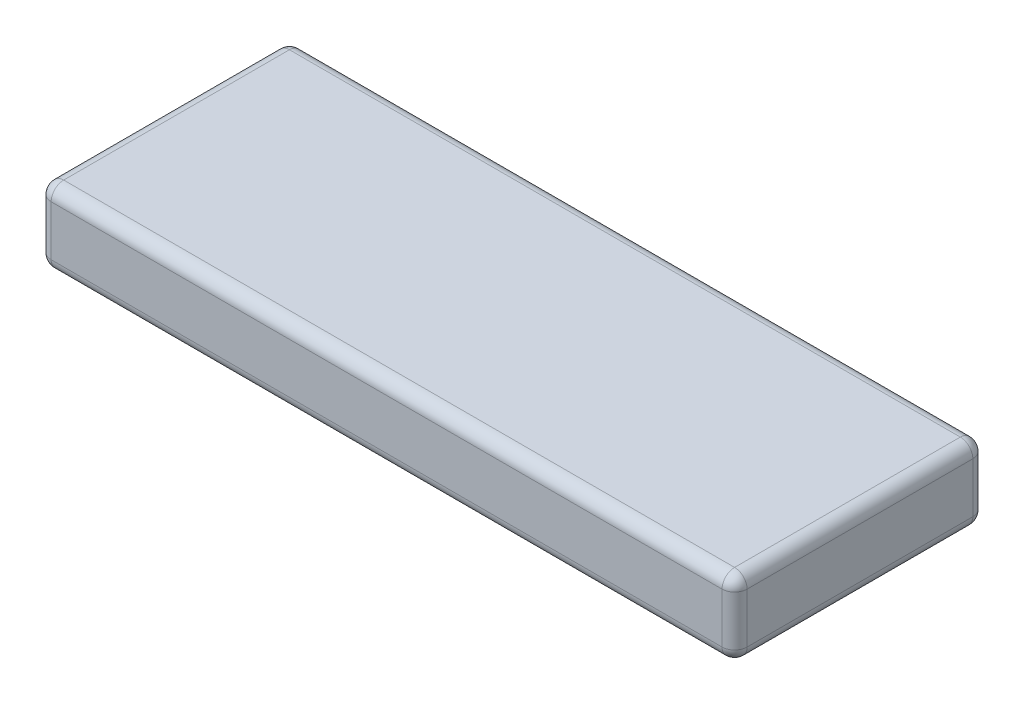
from build123d import *

# Parameters (mm, degrees)
ESBO_O1_W                = 111
ESBO_O1_H                = 40
RESSALTO_EXTRUS_O1_DEPTH = 12
FILETE1_R                = 2
FILETE2_R                = 2


with BuildPart() as part:
    # Esboço1 → Ressalto-extrusão1 (new body)
    with BuildSketch(Plane(origin=(0, 0, 0), x_dir=(1, 0, 0), z_dir=(0, 1, 0))):
        with Locations((55.5, 20)):
            Rectangle(ESBO_O1_W, ESBO_O1_H)
    extrude(amount=RESSALTO_EXTRUS_O1_DEPTH)

    # Filete1
    filete1_edges = [part.edges().sort_by_distance(p)[0] for p in [
        (111, 12, -20),
        (55.5, 12, -40),
        (0, 12, -20),
        (55.5, 0, -40),
        (111, 0, -20),
        (55.5, 0, 0),
        (0, 0, -20),
        (55.5, 12, 0),
    ]]
    fillet(filete1_edges, radius=FILETE1_R)

    # Filete2
    # the kernel refuses this fillet: 2 mm, written as the material it takes off along each edge
    with BuildSketch(Plane(origin=(2, 2, -38), x_dir=(0, 0, -1), z_dir=(-1, 0, 0))) as filete2_piece_1_section:
        Polygon((0, 0), (FILETE2_R, 0), (FILETE2_R, FILETE2_R), (0, FILETE2_R), align=None)
    filete2_piece_1 = extrude(amount=FILETE2_R, mode=Mode.PRIVATE)
    filete2_piece_1 = filete2_piece_1 - Plane(origin=(2, 2, -38), x_dir=(0, 0.7071067811865475, 0.7071067811865475), z_dir=(-1, 0, 0)) * Sphere(FILETE2_R, mode=Mode.PRIVATE)
    add(filete2_piece_1, mode=Mode.SUBTRACT)
    with BuildSketch(Plane(origin=(109, 2, -38), x_dir=(0, 0, -1), z_dir=(1, 0, 0))) as filete2_piece_2_section:
        Polygon((0, 0), (FILETE2_R, 0), (FILETE2_R, -FILETE2_R), (0, -FILETE2_R), align=None)
    filete2_piece_2 = extrude(amount=FILETE2_R, mode=Mode.PRIVATE)
    filete2_piece_2 = filete2_piece_2 - Plane(origin=(109, 2, -38), x_dir=(0, 0.7071067811865475, 0.7071067811865475), z_dir=(1, 0, 0)) * Sphere(FILETE2_R, mode=Mode.PRIVATE)
    add(filete2_piece_2, mode=Mode.SUBTRACT)
    with BuildSketch(Plane(origin=(2, 2, -2), x_dir=(-1, 0, 0), z_dir=(0, 0, 1))) as filete2_piece_3_section:
        Polygon((0, 0), (FILETE2_R, 0), (FILETE2_R, FILETE2_R), (0, FILETE2_R), align=None)
    filete2_piece_3 = extrude(amount=FILETE2_R, mode=Mode.PRIVATE)
    filete2_piece_3 = filete2_piece_3 - Plane(origin=(2, 2, -2), x_dir=(0.7071067811865475, 0.7071067811865475, 0), z_dir=(0, 0, 1)) * Sphere(FILETE2_R, mode=Mode.PRIVATE)
    add(filete2_piece_3, mode=Mode.SUBTRACT)
    with BuildSketch(Plane(origin=(109, 2, -2), x_dir=(1, 0, 0), z_dir=(0, 0, 1))) as filete2_piece_4_section:
        Polygon((0, 0), (FILETE2_R, 0), (FILETE2_R, -FILETE2_R), (0, -FILETE2_R), align=None)
    filete2_piece_4 = extrude(amount=FILETE2_R, mode=Mode.PRIVATE)
    filete2_piece_4 = filete2_piece_4 - Plane(origin=(109, 2, -2), x_dir=(-0.7071067811865475, 0.7071067811865475, 0), z_dir=(0, 0, 1)) * Sphere(FILETE2_R, mode=Mode.PRIVATE)
    add(filete2_piece_4, mode=Mode.SUBTRACT)
    with BuildSketch(Plane(origin=(109, 10, -2), x_dir=(1, 0, 0), z_dir=(0, 0, 1))) as filete2_piece_5_section:
        Polygon((0, 0), (FILETE2_R, 0), (FILETE2_R, FILETE2_R), (0, FILETE2_R), align=None)
    filete2_piece_5 = extrude(amount=FILETE2_R, mode=Mode.PRIVATE)
    filete2_piece_5 = filete2_piece_5 - Plane(origin=(109, 10, -2), x_dir=(-0.7071067811865475, -0.7071067811865475, 0), z_dir=(0, 0, 1)) * Sphere(FILETE2_R, mode=Mode.PRIVATE)
    add(filete2_piece_5, mode=Mode.SUBTRACT)
    with BuildSketch(Plane(origin=(2, 10, -2), x_dir=(-1, 0, 0), z_dir=(0, 0, 1))) as filete2_piece_6_section:
        Polygon((0, 0), (FILETE2_R, 0), (FILETE2_R, -FILETE2_R), (0, -FILETE2_R), align=None)
    filete2_piece_6 = extrude(amount=FILETE2_R, mode=Mode.PRIVATE)
    filete2_piece_6 = filete2_piece_6 - Plane(origin=(2, 10, -2), x_dir=(0.7071067811865475, -0.7071067811865475, 0), z_dir=(0, 0, 1)) * Sphere(FILETE2_R, mode=Mode.PRIVATE)
    add(filete2_piece_6, mode=Mode.SUBTRACT)
    with BuildSketch(Plane(origin=(109, 10, -38), x_dir=(0, 0, -1), z_dir=(1, 0, 0))) as filete2_piece_7_section:
        Polygon((0, 0), (FILETE2_R, 0), (FILETE2_R, FILETE2_R), (0, FILETE2_R), align=None)
    filete2_piece_7 = extrude(amount=FILETE2_R, mode=Mode.PRIVATE)
    filete2_piece_7 = filete2_piece_7 - Plane(origin=(109, 10, -38), x_dir=(0, -0.7071067811865475, 0.7071067811865475), z_dir=(1, 0, 0)) * Sphere(FILETE2_R, mode=Mode.PRIVATE)
    add(filete2_piece_7, mode=Mode.SUBTRACT)
    with BuildSketch(Plane(origin=(2, 10, -38), x_dir=(0, 0, -1), z_dir=(-1, 0, 0))) as filete2_piece_8_section:
        Polygon((0, 0), (FILETE2_R, 0), (FILETE2_R, -FILETE2_R), (0, -FILETE2_R), align=None)
    filete2_piece_8 = extrude(amount=FILETE2_R, mode=Mode.PRIVATE)
    filete2_piece_8 = filete2_piece_8 - Plane(origin=(2, 10, -38), x_dir=(0, -0.7071067811865475, 0.7071067811865475), z_dir=(-1, 0, 0)) * Sphere(FILETE2_R, mode=Mode.PRIVATE)
    add(filete2_piece_8, mode=Mode.SUBTRACT)
    with BuildSketch(Plane(origin=(111, 2, 0), x_dir=(-1, 0, 0), z_dir=(0, 1, 0)), Plane(origin=(111, 2, -40), x_dir=(0, 0, 1), z_dir=(0, 1, 0))) as filete2_piece_9:
        with BuildLine():
            CenterArc((FILETE2_R, -FILETE2_R), FILETE2_R, 90, 90)
            Line((0, -FILETE2_R), (0, 0))
            Line((0, 0), (FILETE2_R, 0))
        make_face()
    extrude(amount=8, mode=Mode.SUBTRACT)
    with BuildSketch(Plane(origin=(0, 2, 0), x_dir=(1, 0, 0), z_dir=(0, 1, 0)), Plane(origin=(0, 2, -40), x_dir=(0, 0, 1), z_dir=(0, 1, 0))) as filete2_piece_10:
        with BuildLine():
            CenterArc((FILETE2_R, FILETE2_R), FILETE2_R, 180, 90)
            Line((0, FILETE2_R), (0, 0))
            Line((0, 0), (FILETE2_R, 0))
        make_face()
    extrude(amount=8, mode=Mode.SUBTRACT)


solid = part.part
